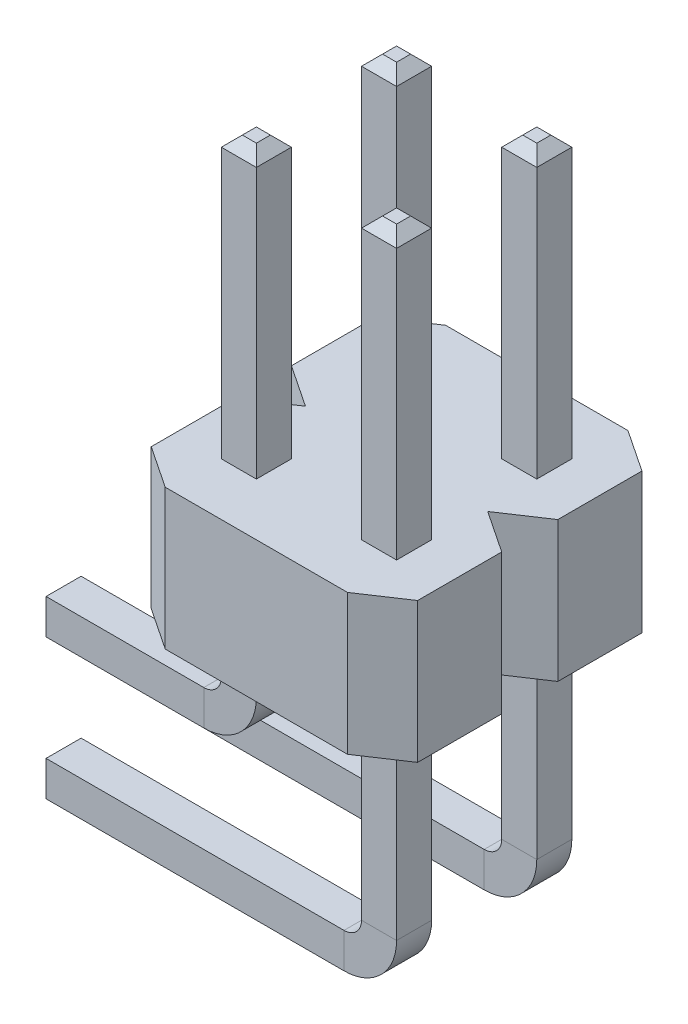
from build123d import *

# Parameters (mm, degrees)
BOSS_EXTRUDE2_DEPTH = 2.54
SKETCH5_W           = 0.635
SKETCH5_H           = 0.635
SKETCH6_W           = 0.635
SKETCH6_H           = 0.635
CHAMFER1_SIZE       = 0.1905


with BuildPart() as part:
    # Sketch1 → Boss-Extrude2 (new body)
    with BuildSketch(Plane(origin=(0, 0, 0), x_dir=(1, 0, 0), z_dir=(0, 1, 0))):
        Polygon((-2.413, -0.762), (-1.651, -1.27), (1.651, -1.27), (2.413, -0.762), (2.413, 0.762), (1.651, 1.27), (-1.651, 1.27), (-2.413, 0.762), align=None)
    extrude(amount=BOSS_EXTRUDE2_DEPTH)

    # Sweep5: sweep along a path in Sketch2
    with BuildLine(Plane.XY) as sweep5_path:
        Line((-1.27, 7.62), (-1.27, 2.54))
        Line((-1.27, 2.54), (-1.27, -0.889))
        ThreePointArc((-1.27, -0.889), (-1.455987194, -1.338012806), (-1.905, -1.524))
        Line((-1.905, -1.524), (-4.953, -1.524))
    # Sketch5 → Sweep5 (sweep)
    with BuildSketch(Plane(origin=(0, 7.62, 0), x_dir=(1, 0, 0), z_dir=(0, 1, 0))):
        with Locations((-1.27, 0)):
            Rectangle(SKETCH5_W, SKETCH5_H)
    sweep(path=sweep5_path.line)

    # Sweep6: sweep along a path in Sketch7
    with BuildLine(Plane.XY) as sweep6_path:
        Line((-4.953, -4.064), (0.635, -4.064))
        ThreePointArc((0.635, -4.064), (1.084012806, -3.878012806), (1.27, -3.429))
        Line((1.27, -3.429), (1.27, 2.54))
        Line((1.27, 2.54), (1.27, 7.62))
    # Sketch6 → Sweep6 (sweep)
    with BuildSketch(Plane(origin=(0, 7.62, 0), x_dir=(1, 0, 0), z_dir=(0, 1, 0))):
        with Locations((1.27, 0)):
            Rectangle(SKETCH6_W, SKETCH6_H)
    sweep(path=sweep6_path.line)

    # Chamfer1
    chamfer1_edges = [part.edges().sort_by_distance(p)[0] for p in [
        (-4.953, -4.064, -0.3175),
        (-4.953, -3.7465, 0),
        (-4.953, -4.064, 0.3175),
        (-4.953, -4.3815, 0),
        (-4.953, -1.2065, 0),
        (-4.953, -1.524, 0.3175),
        (-4.953, -1.8415, 0),
        (-4.953, -1.524, -0.3175),
        (-0.9525, 7.62, 0),
        (-1.27, 7.62, 0.3175),
        (-1.5875, 7.62, 0),
        (-1.27, 7.62, -0.3175),
        (1.27, 7.62, 0.3175),
        (0.9525, 7.62, 0),
        (1.27, 7.62, -0.3175),
        (1.5875, 7.62, 0),
    ]]
    chamfer(chamfer1_edges, length=CHAMFER1_SIZE)

    # Mirror1: part across plane


with BuildPart() as part_1:
    add(part.part)
    add(part.part.mirror(Plane(origin=(-1.651, 2.54, -1.27), x_dir=(1, 0, 0), z_dir=(0, 0, 1))))


solid = part_1.part
